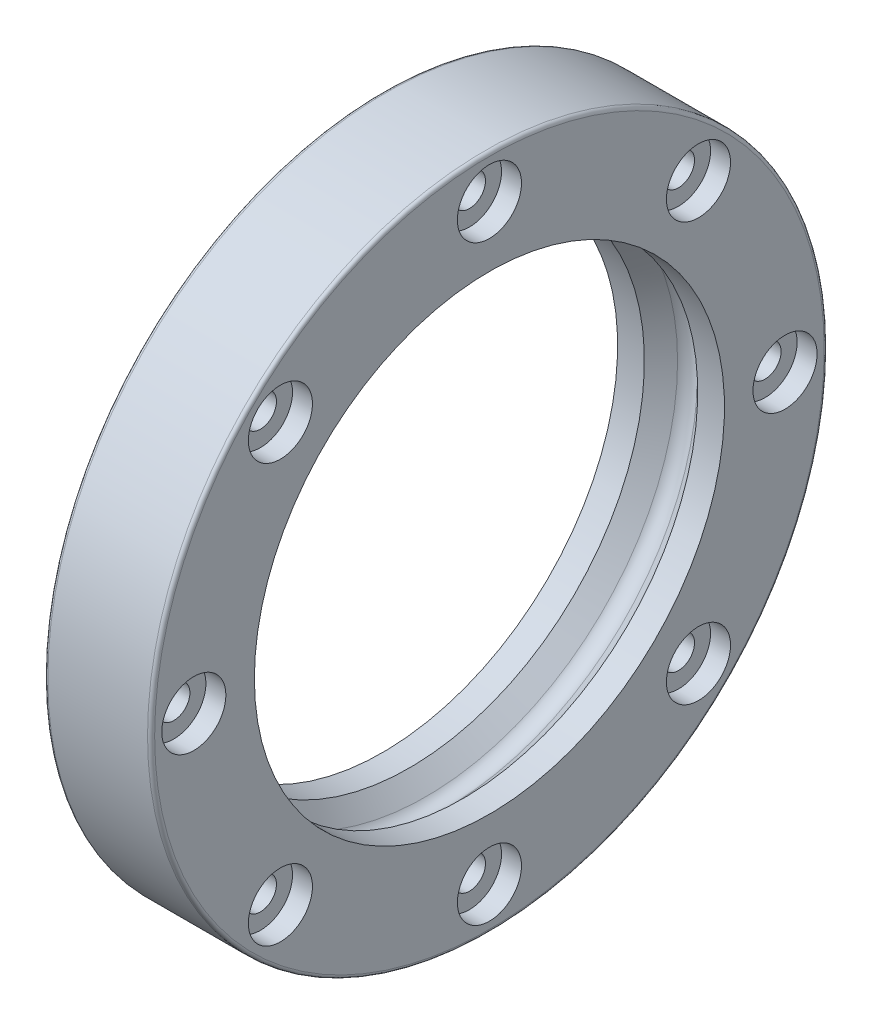
from build123d import *

# Parameters (mm, degrees)
FILLET1_R                                    = 2
FILLET2_R                                    = 0.5
CBORE_FOR_M4_HEX_HEAD_CAP_SCREW1_D           = 4.5
CBORE_FOR_M4_HEX_HEAD_CAP_SCREW1_CBORE_D     = 9
CBORE_FOR_M4_HEX_HEAD_CAP_SCREW1_CBORE_DEPTH = 2.8
CIRPATTERN1_COUNT                            = 8


with BuildPart() as part:
    # Sketch1 → Revolve1 (revolve)
    with BuildSketch(Plane.XY):
        Polygon((-3.742640687, 33), (0, 36.742640687), (3.742640687, 33), (7.5, 33), (7.5, 47.5), (-7.5, 47.5), (-7.5, 33), align=None)
    revolve(axis=Axis((-33.732241936, 0, 0), (1, 0, 0)))

    # Fillet1
    fillet1_edges = [part.edges().sort_by_distance(p)[0] for p in [
        (0, -36.742640687, 0),
    ]]
    fillet(fillet1_edges, radius=FILLET1_R)

    # Fillet2
    fillet2_edges = [part.edges().sort_by_distance(p)[0] for p in [
        (7.5, -47.5, 0),
        (-7.5, -47.5, 0),
    ]]
    fillet(fillet2_edges, radius=FILLET2_R)

    # CBORE for M4 Hex Head Cap Screw1 (through all)
    with Locations(Plane(origin=(7.5, 41.5, 0), x_dir=(0, 0, 1), z_dir=(1, 0, 0))):
        with Locations((0, 0)):
            cbore_for_m4_hex_head_cap_screw1 = CounterBoreHole(CBORE_FOR_M4_HEX_HEAD_CAP_SCREW1_D / 2, CBORE_FOR_M4_HEX_HEAD_CAP_SCREW1_CBORE_D / 2, CBORE_FOR_M4_HEX_HEAD_CAP_SCREW1_CBORE_DEPTH)

    # CirPattern1: CBORE for M4 Hex Head Cap Screw1 ×8 about axis
    cirpattern1_axis = Axis((7.5, 0, 0), (-1, 0, 0))
    for i in range(1, CIRPATTERN1_COUNT):
        add(cbore_for_m4_hex_head_cap_screw1.rotate(cirpattern1_axis, i * 360 / CIRPATTERN1_COUNT), mode=Mode.SUBTRACT)


solid = part.part
